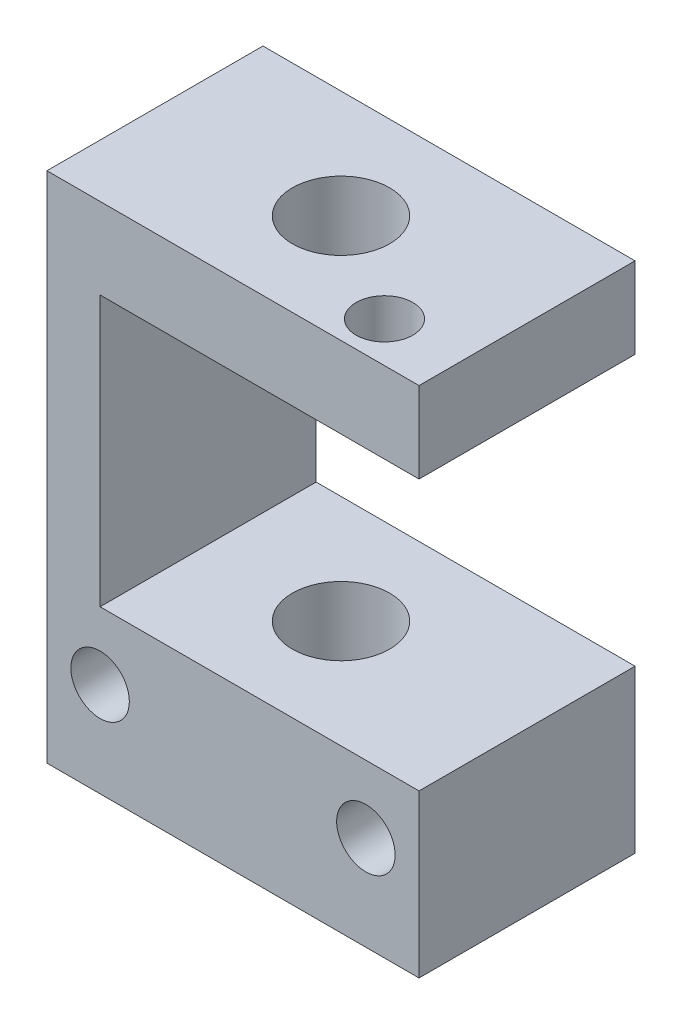
from build123d import *

# Parameters (mm, degrees)
SKETCH2_W            = 35
SKETCH2_H            = 20.32
SKETCH2_R            = 4.572
BOSS_EXTRUDE1_DEPTH  = 48.26
M5_CLEARANCE_HOLE1_D = 5.5
SKETCH7_R            = 2.667
CUT_EXTRUDE1_DEPTH   = 5
SKETCH8_W            = 30
SKETCH8_H            = 25.4
CUT_EXTRUDE2_DEPTH   = 63.983569286


with BuildPart() as part:
    # Sketch2 → Boss-Extrude1 (new body)
    with BuildSketch(Plane(origin=(0, 0, 0), x_dir=(1, 0, 0), z_dir=(0, 1, 0))):
        with Locations((17.5, 10.16)):
            Rectangle(SKETCH2_W, SKETCH2_H)
        with Locations((17.5, 10.16)):
            Circle(SKETCH2_R, mode=Mode.SUBTRACT)
    extrude(amount=BOSS_EXTRUDE1_DEPTH)

    # M5 Clearance Hole1 (through all)
    with Locations(Plane.XY):
        with Locations((5, 8.89), (30, 8.89)):
            Hole(M5_CLEARANCE_HOLE1_D / 2)

    # Sketch7 → Cut-Extrude1 (cut)
    with BuildSketch(Plane(origin=(0, 48.26, 0), x_dir=(1, 0, 0), z_dir=(0, 1, 0))):
        with Locations((27.94, 3.81)):
            Circle(SKETCH7_R)
    extrude(amount=-CUT_EXTRUDE1_DEPTH, mode=Mode.SUBTRACT)

    # Sketch8 → Cut-Extrude2 (cut, through all)
    with BuildSketch(Plane(origin=(0, 0, -20.32), x_dir=(-1, 0, 0), z_dir=(0, 0, -1))):
        with Locations((-20, 27.94)):
            Rectangle(SKETCH8_W, SKETCH8_H)
    extrude(amount=-CUT_EXTRUDE2_DEPTH, mode=Mode.SUBTRACT)


solid = part.part
